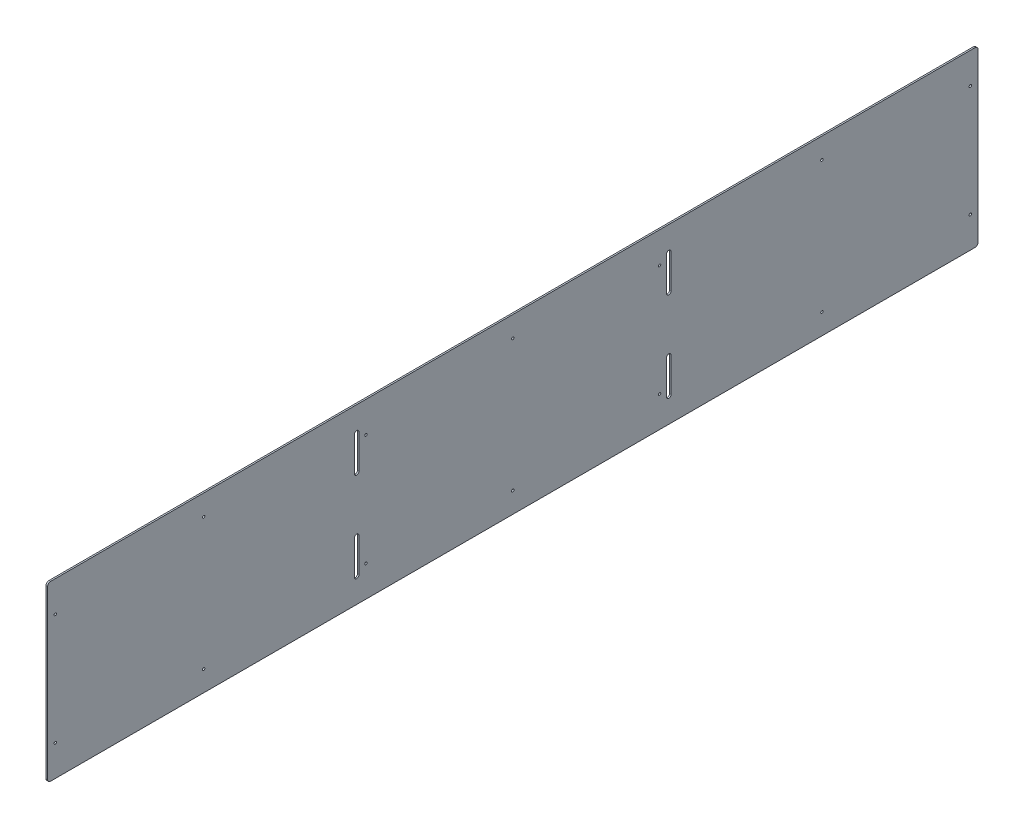
from build123d import *

# Parameters (mm, degrees)
SKETCH1_W           = 1911.35
SKETCH1_H           = 355.6
BOSS_EXTRUDE1_DEPTH = 3.175
SKETCH2_R           = 2.4511
CUT_EXTRUDE1_DEPTH  = 1945.15026763
FILLET1_R           = 6.35
CUT_EXTRUDE2_DEPTH  = 1945.15026763


with BuildPart() as part:
    # Sketch1 → Boss-Extrude1 (new body)
    with BuildSketch(Plane(origin=(0, 0, 0), x_dir=(0, 0, -1), z_dir=(1, 0, 0))):
        with Locations((955.675, 177.8)):
            Rectangle(SKETCH1_W, SKETCH1_H)
    extrude(amount=BOSS_EXTRUDE1_DEPTH)

    # Sketch2 → Cut-Extrude1 (cut, through all)
    with BuildSketch(Plane(origin=(3.175, 0, 0), x_dir=(0, 0, -1), z_dir=(1, 0, 0))):
        with Locations((15.875, 292.1)):
            Circle(SKETCH2_R)
        with Locations((654.05, 292.1)):
            Circle(SKETCH2_R)
        with Locations((320.675, 313.182)):
            Circle(SKETCH2_R)
        with Locations((955.675, 313.182)):
            Circle(SKETCH2_R)
        with Locations((1590.675, 313.182)):
            Circle(SKETCH2_R)
        with Locations((955.675, 42.418)):
            Circle(SKETCH2_R)
        with Locations((1590.675, 42.418)):
            Circle(SKETCH2_R)
        with Locations((320.675, 42.418)):
            Circle(SKETCH2_R)
        with Locations((15.875, 63.5)):
            Circle(SKETCH2_R)
        with Locations((654.05, 63.5)):
            Circle(SKETCH2_R)
        with Locations((1895.475, 63.5)):
            Circle(SKETCH2_R)
        with Locations((1895.475, 292.1)):
            Circle(SKETCH2_R)
        with Locations((1257.3, 63.5)):
            Circle(SKETCH2_R)
        with Locations((1257.3, 292.1)):
            Circle(SKETCH2_R)
    extrude(amount=-CUT_EXTRUDE1_DEPTH, mode=Mode.SUBTRACT)

    # Fillet1
    fillet1_edges = [part.edges().sort_by_distance(p)[0] for p in [
        (1.5875, 0, -1911.35),
        (1.5875, 355.6, -1911.35),
        (1.5875, 0, 0),
        (1.5875, 355.6, 0),
    ]]
    fillet(fillet1_edges, radius=FILLET1_R)

    # Sketch3 → Cut-Extrude2 (cut, through all)
    with BuildSketch(Plane(origin=(3.175, 0, 0), x_dir=(0, 0, -1), z_dir=(1, 0, 0))):
        with BuildLine():
            Line((639.7625, 304.8), (639.7625, 234.95))
            ThreePointArc((639.7625, 234.95), (635, 230.1875), (630.2375, 234.95))
            Line((630.2375, 234.95), (630.2375, 304.8))
            ThreePointArc((630.2375, 304.8), (635, 309.5625), (639.7625, 304.8))
        make_face()
        with BuildLine():
            Line((1281.1125, 304.8), (1281.1125, 234.95))
            ThreePointArc((1281.1125, 234.95), (1276.35, 230.1875), (1271.5875, 234.95))
            Line((1271.5875, 234.95), (1271.5875, 304.8))
            ThreePointArc((1271.5875, 304.8), (1276.35, 309.5625), (1281.1125, 304.8))
        make_face()
        with BuildLine():
            Line((1281.1125, 50.8), (1281.1125, 120.65))
            ThreePointArc((1281.1125, 120.65), (1276.35, 125.4125), (1271.5875, 120.65))
            Line((1271.5875, 120.65), (1271.5875, 50.8))
            ThreePointArc((1271.5875, 50.8), (1276.35, 46.0375), (1281.1125, 50.8))
        make_face()
        with BuildLine():
            Line((639.7625, 50.8), (639.7625, 120.65))
            ThreePointArc((639.7625, 120.65), (635, 125.4125), (630.2375, 120.65))
            Line((630.2375, 120.65), (630.2375, 50.8))
            ThreePointArc((630.2375, 50.8), (635, 46.0375), (639.7625, 50.8))
        make_face()
    extrude(amount=-CUT_EXTRUDE2_DEPTH, mode=Mode.SUBTRACT)


solid = part.part
